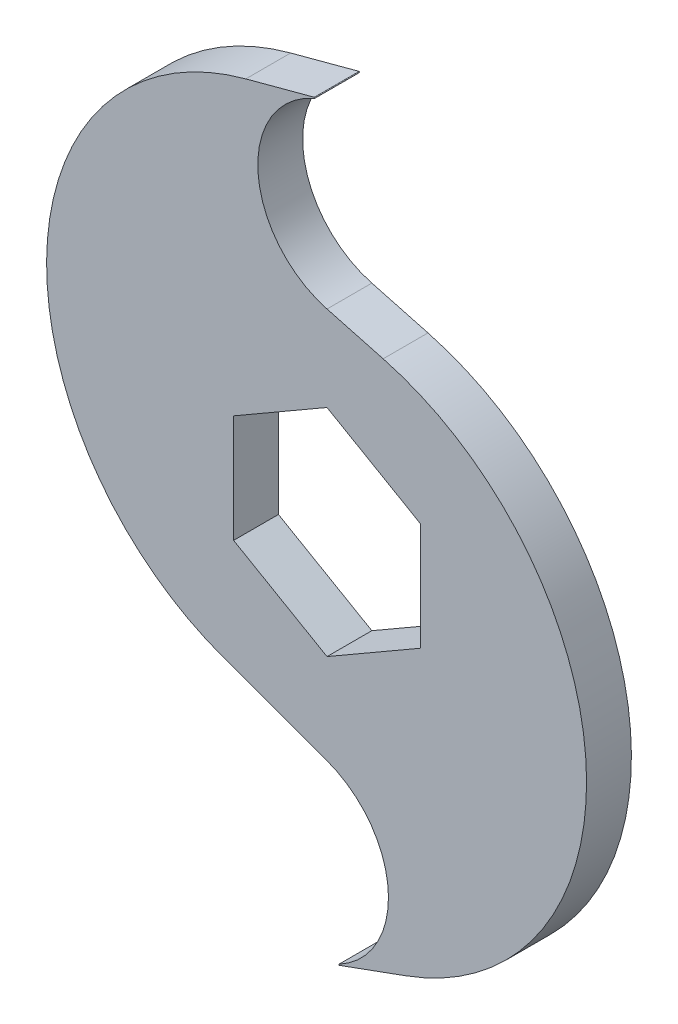
from build123d import *

# Parameters (mm, degrees)
BOSS_EXTRUDE1_DEPTH = 3.048
FILLET1_R           = 0.0635


with BuildPart() as part:
    # Sketch1 → Boss-Extrude1 (new, symmetric)
    with BuildSketch(Plane.XY):
        with BuildLine():
            Line((0, 50.8), (-11.040532194, 47.841698314))
            ThreePointArc((-11.040532194, 47.841698314), (-38.095102898, 14.132401849), (-14.081441775, -21.80658177))
            Line((-14.081441775, -21.80658177), (0, -26.931807432))
            ThreePointArc((0, -26.931807432), (8.35634418, -38.865903716), (0, -50.8))
            Line((0, -50.8), (10.740686656, -46.890709762))
            ThreePointArc((10.740686656, -46.890709762), (35.258377113, -10.197392936), (7.635950588, 24.219437219))
            Line((7.635950588, 24.219437219), (0, 26.265484012))
            ThreePointArc((0, 26.265484012), (-9.412998127, 38.532742006), (0, 50.8))
        make_face()
        Polygon((0, 14.664696837), (-12.7, 7.332348419), (-12.7, -7.332348419), (0, -14.664696837), (12.7, -7.332348419), (12.7, 7.332348419), align=None, mode=Mode.SUBTRACT)
    extrude(amount=BOSS_EXTRUDE1_DEPTH, both=True)

    # Fillet1
    fillet1_edges = [part.edges().sort_by_distance(p)[0] for p in [
        (0, 50.8, 0),
        (0, -50.8, 0),
    ]]
    fillet(fillet1_edges, radius=FILLET1_R)


solid = part.part
